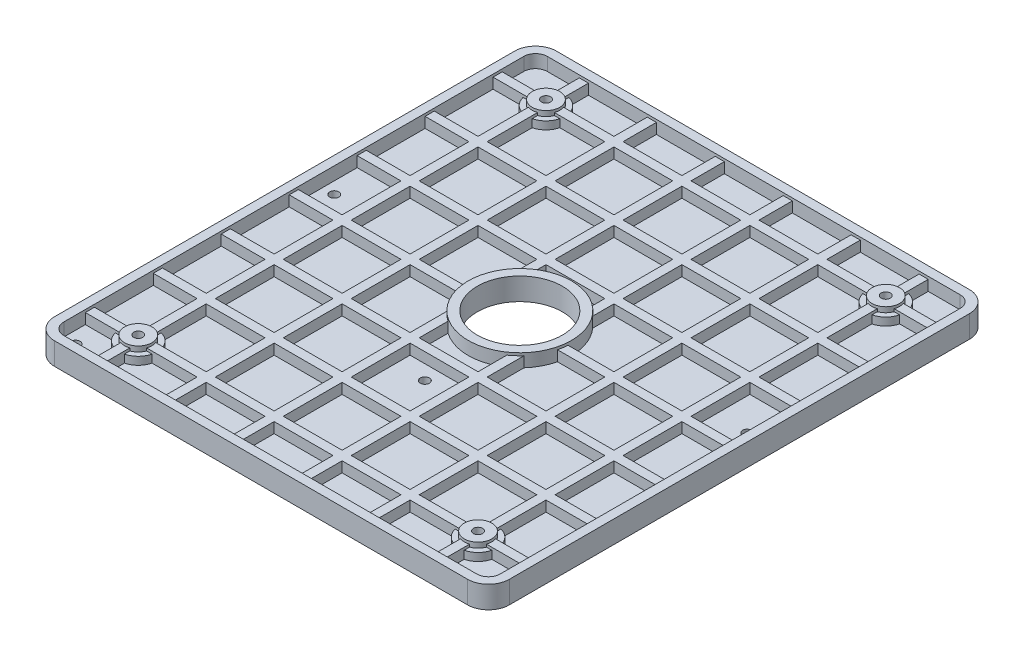
from build123d import *
from build123d.topology import SkipClean

# Parameters (mm, degrees)
BOSS_EXTRUDE1_OUTLINE_R   = 1.75
BOSS_EXTRUDE1_OUTLINE_R_2 = 16.25
BOSS_EXTRUDE1_DEPTH       = 8.5
SKETCH5_R                 = 3.75
CUT_EXTRUDE2_DEPTH        = 3
SHELL1_T                  = -3.5
SKETCH2_W                 = 167
SKETCH2_H                 = 3.5
BOSS_EXTRUDE2_DEPTH       = 4
BOSS_EXTRUDE3_REACH       = 261.162
SKETCH3_W                 = 3.5
SKETCH3_H                 = 185
SKETCH4_R                 = 1.75
SKETCH4_R_2               = 16.25
CUT_EXTRUDE1_DEPTH        = 8.5


# Read off the part's stored shape, not the designer's step: Boss-Extrude1
with BuildPart() as part:
    # Boss-Extrude1 outline → Boss-Extrude1 (new body)
    with BuildSketch(Plane(origin=(0, 0, 0), x_dir=(1, 0, 0), z_dir=(0, 1, 0))):
        with BuildLine():
            ThreePointArc((0, 8), (2.343145751, 2.343145751), (8, 0))
            Line((8, 0), (166, 0))
            ThreePointArc((166, 0), (171.656854249, 2.343145751), (174, 8))
            Line((174, 8), (174, 184))
            ThreePointArc((174, 184), (171.656854249, 189.656854249), (166, 192))
            Line((166, 192), (8, 192))
            ThreePointArc((8, 192), (2.343145751, 189.656854249), (0, 184))
            Line((0, 184), (0, 8))
        make_face()
        with Locations((22, 18)):
            Circle(BOSS_EXTRUDE1_OUTLINE_R, mode=Mode.SUBTRACT)
        with Locations((152, 18)):
            Circle(BOSS_EXTRUDE1_OUTLINE_R, mode=Mode.SUBTRACT)
        with Locations((22, 174)):
            Circle(BOSS_EXTRUDE1_OUTLINE_R, mode=Mode.SUBTRACT)
        with Locations((87, 99)):
            Circle(BOSS_EXTRUDE1_OUTLINE_R_2, mode=Mode.SUBTRACT)
        with Locations((152, 174)):
            Circle(BOSS_EXTRUDE1_OUTLINE_R, mode=Mode.SUBTRACT)
    extrude(amount=BOSS_EXTRUDE1_DEPTH)

    # Sketch5 → Cut-Extrude2 (cut)
    with BuildSketch(Plane.XZ):
        with Locations(Location((22, -18, 0), (0, 0, 270))):
            Circle(SKETCH5_R)
        with Locations(Location((152, -18, 0), (0, 0, 270))):
            Circle(SKETCH5_R)
        with Locations(Location((152, -174, 0), (0, 0, 270))):
            Circle(SKETCH5_R)
        with Locations(Location((22, -174, 0), (0, 0, 270))):
            Circle(SKETCH5_R)
    extrude(amount=-CUT_EXTRUDE2_DEPTH, mode=Mode.SUBTRACT)

    # Shell1
    shell1_openings = [part.faces().sort_by_distance(p)[0] for p in [
        (2.591138746, 8.5, -96),
    ]]
    offset(amount=SHELL1_T, openings=shell1_openings, kind=Kind.INTERSECTION)

    # Sketch2 → Boss-Extrude2 (add)
    with BuildSketch(Plane(origin=(0, 3.5, 0), x_dir=(1, 0, 0), z_dir=(0, 1, 0))):
        with Locations((87, 174)):
            Rectangle(SKETCH2_W, SKETCH2_H)
        with Locations((87, 148)):
            Rectangle(SKETCH2_W, SKETCH2_H)
        with Locations((87, 122)):
            Rectangle(SKETCH2_W, SKETCH2_H)
        with Locations((87, 96)):
            Rectangle(SKETCH2_W, SKETCH2_H)
        with Locations((87, 70)):
            Rectangle(SKETCH2_W, SKETCH2_H)
        with Locations((87, 44)):
            Rectangle(SKETCH2_W, SKETCH2_H)
        with Locations((87, 18)):
            Rectangle(SKETCH2_W, SKETCH2_H)
    extrude(amount=BOSS_EXTRUDE2_DEPTH)

    # Boss-Extrude3: up to this face of the body (flat: up to its plane)
    boss_extrude3_end = Plane(part.part.faces().sort_by_distance((10.174752881, 7.5, -174))[0])
    # Sketch3 → Boss-Extrude3 (add, up to the picked face)
    with BuildSketch(Plane(origin=(0, 3.5, 0), x_dir=(1, 0, 0), z_dir=(0, 1, 0)), mode=Mode.PRIVATE) as boss_extrude3_sk1:
        with Locations((22, 96)):
            Rectangle(SKETCH3_W, SKETCH3_H)
    boss_extrude3_tool1 = split(extrude(boss_extrude3_sk1.sketch, amount=BOSS_EXTRUDE3_REACH, mode=Mode.PRIVATE), bisect_by=boss_extrude3_end, keep=Keep.BOTH, mode=Mode.PRIVATE)
    # Sketch3 → Boss-Extrude3 (add, up to the picked face)
    with BuildSketch(Plane(origin=(0, 3.5, 0), x_dir=(1, 0, 0), z_dir=(0, 1, 0)), mode=Mode.PRIVATE) as boss_extrude3_sk2:
        with Locations((48, 96)):
            Rectangle(SKETCH3_W, SKETCH3_H)
    boss_extrude3_tool2 = split(extrude(boss_extrude3_sk2.sketch, amount=BOSS_EXTRUDE3_REACH, mode=Mode.PRIVATE), bisect_by=boss_extrude3_end, keep=Keep.BOTH, mode=Mode.PRIVATE)
    # Sketch3 → Boss-Extrude3 (add, up to the picked face)
    with BuildSketch(Plane(origin=(0, 3.5, 0), x_dir=(1, 0, 0), z_dir=(0, 1, 0)), mode=Mode.PRIVATE) as boss_extrude3_sk3:
        with Locations((74, 96)):
            Rectangle(SKETCH3_W, SKETCH3_H)
    boss_extrude3_tool3 = split(extrude(boss_extrude3_sk3.sketch, amount=BOSS_EXTRUDE3_REACH, mode=Mode.PRIVATE), bisect_by=boss_extrude3_end, keep=Keep.BOTH, mode=Mode.PRIVATE)
    # Sketch3 → Boss-Extrude3 (add, up to the picked face)
    with BuildSketch(Plane(origin=(0, 3.5, 0), x_dir=(1, 0, 0), z_dir=(0, 1, 0)), mode=Mode.PRIVATE) as boss_extrude3_sk4:
        with Locations((100, 96)):
            Rectangle(SKETCH3_W, SKETCH3_H)
    boss_extrude3_tool4 = split(extrude(boss_extrude3_sk4.sketch, amount=BOSS_EXTRUDE3_REACH, mode=Mode.PRIVATE), bisect_by=boss_extrude3_end, keep=Keep.BOTH, mode=Mode.PRIVATE)
    # Sketch3 → Boss-Extrude3 (add, up to the picked face)
    with BuildSketch(Plane(origin=(0, 3.5, 0), x_dir=(1, 0, 0), z_dir=(0, 1, 0)), mode=Mode.PRIVATE) as boss_extrude3_sk5:
        with Locations((126, 96)):
            Rectangle(SKETCH3_W, SKETCH3_H)
    boss_extrude3_tool5 = split(extrude(boss_extrude3_sk5.sketch, amount=BOSS_EXTRUDE3_REACH, mode=Mode.PRIVATE), bisect_by=boss_extrude3_end, keep=Keep.BOTH, mode=Mode.PRIVATE)
    # Sketch3 → Boss-Extrude3 (add, up to the picked face)
    with BuildSketch(Plane(origin=(0, 3.5, 0), x_dir=(1, 0, 0), z_dir=(0, 1, 0)), mode=Mode.PRIVATE) as boss_extrude3_sk6:
        with Locations((152, 96)):
            Rectangle(SKETCH3_W, SKETCH3_H)
    boss_extrude3_tool6 = split(extrude(boss_extrude3_sk6.sketch, amount=BOSS_EXTRUDE3_REACH, mode=Mode.PRIVATE), bisect_by=boss_extrude3_end, keep=Keep.BOTH, mode=Mode.PRIVATE)
    add(boss_extrude3_tool1.solids().sort_by(Axis((22, 3.5, -96), (0, 1, 0)))[0])
    add(boss_extrude3_tool2.solids().sort_by(Axis((48, 3.5, -96), (0, 1, 0)))[0])
    add(boss_extrude3_tool3.solids().sort_by(Axis((74, 3.5, -96), (0, 1, 0)))[0])
    add(boss_extrude3_tool4.solids().sort_by(Axis((100, 3.5, -96), (0, 1, 0)))[0])
    add(boss_extrude3_tool5.solids().sort_by(Axis((126, 3.5, -96), (0, 1, 0)))[0])
    add(boss_extrude3_tool6.solids().sort_by(Axis((152, 3.5, -96), (0, 1, 0)))[0])

    # Sketch4 → Cut-Extrude1 (cut)
    with SkipClean():  # the faces are left unmerged after this step: merging them gives an invalid solid
        with BuildSketch(Plane.XZ):
            with Locations(Location((22, -174, 0), (0, 0, 270))):
                Circle(SKETCH4_R)
            with Locations(Location((152, -174, 0), (0, 0, 270))):
                Circle(SKETCH4_R)
            with Locations(Location((152, -18, 0), (0, 0, 270))):
                Circle(SKETCH4_R)
            with Locations(Location((87, -99, 0), (0, 0, 90))):
                Circle(SKETCH4_R_2)
            with Locations(Location((22, -18, 0), (0, 0, 270))):
                Circle(SKETCH4_R)
            with Locations(Location((87, -62.65101225, 0), (0, 0, 270))):
                Circle(SKETCH4_R)
            with Locations(Location((8, -8, 0), (0, 0, 270))):
                Circle(SKETCH4_R)
            with Locations(Location((166, -8, 0), (0, 0, 270))):
                Circle(SKETCH4_R)
            with Locations(Location((166, -107, 0), (0, 0, 270))):
                Circle(SKETCH4_R)
            with Locations(Location((8, -107, 0), (0, 0, 270))):
                Circle(SKETCH4_R)
        extrude(amount=-CUT_EXTRUDE1_DEPTH, mode=Mode.SUBTRACT)
    add(part.part.scale(1), mode=Mode.REPLACE)  # the faces are merged on a copy


solid = part.part
